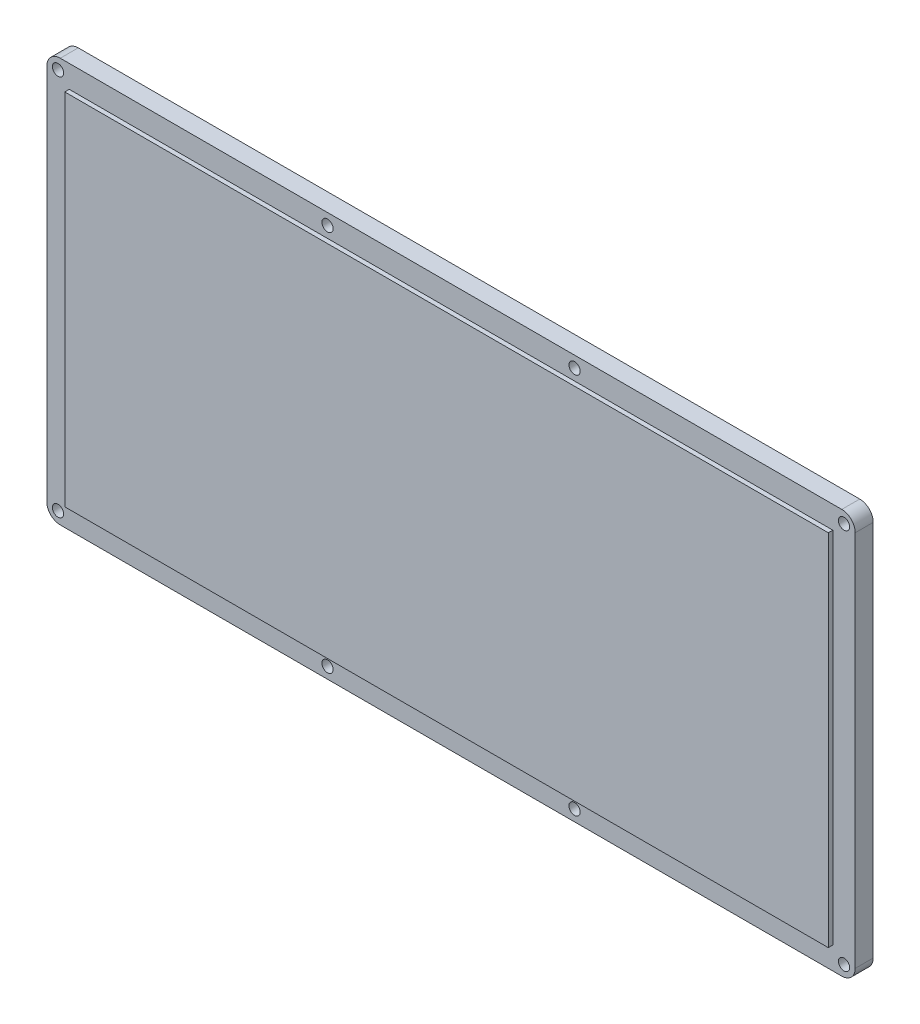
from build123d import *

# Parameters (mm, degrees)
SKETCH1_W           = 180
SKETCH1_H           = 90
BOSS_EXTRUDE1_DEPTH = 4
FILLET1_R           = 3
SKETCH2_W           = 170
SKETCH2_H           = 80
BOSS_EXTRUDE2_DEPTH = 1
SKETCH3_R           = 1.25
CUT_EXTRUDE2_DEPTH  = 10
BOSS_EXTRUDE3_DEPTH = 0.5
BOSS_EXTRUDE4_DEPTH = 0.5


with BuildPart() as part:
    # Sketch1 → Boss-Extrude1 (new body)
    with BuildSketch(Plane.XY):
        Rectangle(SKETCH1_W, SKETCH1_H)
    extrude(amount=BOSS_EXTRUDE1_DEPTH)

    # Fillet1
    fillet1_edges = [part.edges().sort_by_distance(p)[0] for p in [
        (90, 45, 2),
        (90, -45, 2),
        (-90, -45, 2),
        (-90, 45, 2),
    ]]
    fillet(fillet1_edges, radius=FILLET1_R)

    # Sketch2 → Boss-Extrude2 (add)
    with BuildSketch(Plane.XY.offset(4)):
        Rectangle(SKETCH2_W, SKETCH2_H)
    extrude(amount=BOSS_EXTRUDE2_DEPTH)

    # Sketch3 → Cut-Extrude2 (cut)
    with BuildSketch(Plane(origin=(0, 0, 0), x_dir=(-1, 0, 0), z_dir=(0, 0, -1))):
        with Locations((-87.5, 42.5)):
            Circle(SKETCH3_R)
        with Locations((87.5, 42.5)):
            Circle(SKETCH3_R)
        with Locations((87.5, -42.5)):
            Circle(SKETCH3_R)
        with Locations((-87.5, -42.5)):
            Circle(SKETCH3_R)
        with Locations((-27.5, -42.5)):
            Circle(SKETCH3_R)
        with Locations((27.5, 42.5)):
            Circle(SKETCH3_R)
        with Locations((27.5, -42.5)):
            Circle(SKETCH3_R)
        with Locations((-27.5, 42.5)):
            Circle(SKETCH3_R)
    extrude(amount=-CUT_EXTRUDE2_DEPTH, mode=Mode.SUBTRACT)

    # Sketch4 → Boss-Extrude3 (add)
    # profile 1 of 4: a face of its own
    with BuildSketch(Plane(origin=(0, 0, 0), x_dir=(-1, 0, 0), z_dir=(0, 0, -1))):
        with BuildLine():
            add(Edge.make_bspline(
                [(14.352587208, -9.355241917), (14.683794805, -9.363817475), (15.337673619, -9.380747569), (16.299293393, -9.521873111), (17.225991848, -9.751816949), (18.117349934, -10.071455517), (18.971135793, -10.48944625), (19.790361013, -10.993938837), (20.572091168, -11.594455273), (21.308315714, -12.2769865), (21.988719976, -13.019209408), (22.578290666, -13.818344325), (23.081054922, -14.653684863), (23.497747282, -15.527469341), (23.815136073, -16.445749133), (24.037860916, -17.403842226), (24.180950593, -18.401476052), (24.197408108, -19.080728708), (24.205772304, -19.425945042)],
                knots=[0, 0, 0, 0, 1.014329547, 2.002516266, 2.970391464, 3.935626869, 4.897733899, 5.877609409, 6.878433252, 7.912639331, 8.949961323, 9.958554974, 10.949718813, 11.932905612, 12.9188844, 13.919928257, 14.942845884, 16, 16, 16, 16], degree=3))
            add(Edge.make_bspline(
                [(24.205772304, -19.425945042), (24.196864797, -19.767271586), (24.179312268, -20.43986649), (24.043702463, -21.428306728), (23.817226906, -22.376136648), (23.505221277, -23.285501685), (23.096086141, -24.151997188), (22.603126336, -24.981155609), (22.01333359, -25.76528216), (21.34821996, -26.503956048), (20.615987575, -27.174461104), (19.840437238, -27.765342527), (19.025149963, -28.266033146), (18.171319069, -28.676303621), (17.277113558, -28.994699427), (16.344742225, -29.219350805), (15.374262767, -29.355875983), (14.714289672, -29.373313861), (14.379299949, -29.382164994)],
                knots=[0, 0, 0, 0, 1.051557043, 2.072126891, 3.067553643, 4.050577992, 5.02905126, 6.015227836, 7.017913613, 8.04756643, 9.074058332, 10.072836633, 11.047628519, 12.017157415, 12.98668631, 13.966869689, 14.968021931, 16, 16, 16, 16], degree=3))
            add(Edge.make_bspline(
                [(14.379299949, -29.382164994), (14.028940865, -29.374225091), (13.340533156, -29.358624267), (12.333045392, -29.210267552), (11.36778506, -28.986790513), (10.452860902, -28.653263022), (9.578955199, -28.236325613), (8.75248879, -27.722842197), (7.973739425, -27.113661344), (7.247174136, -26.424384403), (6.588904225, -25.670164248), (6.007851908, -24.873397538), (5.51772139, -24.04017087), (5.118494736, -23.170094276), (4.803760479, -22.26857507), (4.581751222, -21.33012274), (4.450605055, -20.356988036), (4.432337156, -19.696015491), (4.423079997, -19.361071244)],
                knots=[0, 0, 0, 0, 1.067978421, 2.098431617, 3.099715153, 4.085208694, 5.062210972, 6.048429807, 7.046490867, 8.072918869, 9.098532598, 10.095778865, 11.076610158, 12.041847152, 13.011192615, 13.984257998, 14.978533688, 16, 16, 16, 16], degree=3))
            add(Edge.make_bspline(
                [(4.423079997, -19.361071244), (4.425985427, -19.135738289), (4.431759497, -18.687925611), (4.501314253, -18.024290081), (4.601453104, -17.373607826), (4.749553714, -16.738473125), (4.929458102, -16.114405398), (5.16254965, -15.507213622), (5.427870911, -14.910411319), (5.737873824, -14.331047472), (6.082567089, -13.774452712), (6.45865813, -13.243252594), (6.867092622, -12.743870103), (7.306554864, -12.273023505), (7.778559301, -11.833807707), (8.276897203, -11.420004998), (8.811233423, -11.042607451), (9.369873018, -10.692398263), (9.949666507, -10.375710168), (10.548253603, -10.106154733), (11.153302231, -9.870756563), (11.772895023, -9.684969919), (12.400391942, -9.533648641), (13.04249652, -9.433577283), (13.693407707, -9.364024453), (14.132339253, -9.358176377), (14.352587208, -9.355241917)],
                knots=[0, 0, 0, 0, 1.034744296, 2.056386356, 3.06226378, 4.057406941, 5.050368692, 6.043467995, 7.042652155, 8.049140477, 9.059438543, 10.048523776, 11.036952808, 12.020949711, 13.004946614, 13.997082645, 14.994316842, 16.007702937, 17.024872941, 18.026463647, 19.021641123, 20.005082605, 20.995858141, 21.984425357, 22.988620895, 24, 24, 24, 24], degree=3))
        make_face()
        with BuildLine():
            add(Edge.make_bspline(
                [(14.299161728, -12.774472687), (14.076259059, -12.780453666), (13.636338388, -12.792257725), (12.99105488, -12.882188692), (12.371559924, -13.025818668), (11.781287626, -13.233864933), (11.217679695, -13.498655026), (10.679737026, -13.819263739), (10.174909016, -14.206711636), (9.69646427, -14.640198369), (9.26426817, -15.123202211), (8.882409282, -15.640822971), (8.562854898, -16.192196231), (8.2952261, -16.772199863), (8.093760929, -17.387355856), (7.950263329, -18.032845625), (7.859578202, -18.709781382), (7.848147229, -19.171247607), (7.842310766, -19.406864514)],
                knots=[0, 0, 0, 0, 1.033739768, 2.040188636, 3.016340934, 3.979330865, 4.937572243, 5.900995986, 6.878200029, 7.884839167, 8.891893314, 9.879764717, 10.863503415, 11.843163062, 12.837761627, 13.859916423, 14.907309254, 16, 16, 16, 16], degree=3))
            add(Edge.make_bspline(
                [(7.842310766, -19.406864514), (7.850049025, -19.667981048), (7.86521473, -20.17972619), (7.971922474, -20.926246215), (8.154488802, -21.631260287), (8.418111031, -22.291320287), (8.745071756, -22.913755687), (9.151105085, -23.490937656), (9.6296352, -24.026322091), (9.998290924, -24.338901824), (10.185399708, -24.49754961)],
                knots=[0, 0, 0, 0, 1.078454662, 2.113592447, 3.107694534, 4.079536787, 5.043276885, 6.005368276, 6.987637804, 8, 8, 8, 8], degree=3))
            add(Edge.make_bspline(
                [(10.185399708, -24.49754961), (10.338677524, -24.6147525), (10.641779781, -24.84651768), (11.125596973, -25.143572303), (11.623833413, -25.398177749), (12.14024892, -25.603895936), (12.673752849, -25.765710405), (13.224272043, -25.879026417), (13.79102646, -25.950142014), (14.174292359, -25.958641675), (14.367851631, -25.962934225)],
                knots=[0, 0, 0, 0, 1.023928204, 2.024787132, 3.009472467, 3.9914905, 4.972207045, 5.96565515, 6.972602802, 8, 8, 8, 8], degree=3))
            add(Edge.make_bspline(
                [(14.367851631, -25.962934225), (14.586921484, -25.956902534), (15.017948307, -25.945034992), (15.651219514, -25.856211125), (16.257912564, -25.705889071), (16.841793859, -25.499667862), (17.401179747, -25.2315531), (17.933336355, -24.901000111), (18.4391967, -24.51206766), (18.917031914, -24.072888297), (19.353795888, -23.587981754), (19.734857915, -23.067600058), (20.064572532, -22.523208776), (20.326635985, -21.947102875), (20.53606059, -21.344720525), (20.677831122, -20.713393903), (20.769282332, -20.055725578), (20.780716526, -19.608159042), (20.786541535, -19.380151773)],
                knots=[0, 0, 0, 0, 1.026359118, 2.019393844, 2.989460624, 3.950973911, 4.916101784, 5.890408035, 6.881132271, 7.902007068, 8.92769091, 9.933912415, 10.920395702, 11.90457117, 12.894218921, 13.903490204, 14.931958862, 16, 16, 16, 16], degree=3))
            add(Edge.make_bspline(
                [(20.786541535, -19.380151773), (20.78051498, -19.153455609), (20.768652624, -18.707238783), (20.679672422, -18.051261319), (20.530303672, -17.422721819), (20.323463202, -16.820593813), (20.059338874, -16.24428699), (19.732722348, -15.695827986), (19.344759681, -15.175747027), (18.90437981, -14.687588267), (18.425053386, -14.239001635), (17.910448576, -13.849709984), (17.374964601, -13.511427916), (16.806314845, -13.246431404), (16.216133405, -13.035309244), (15.600818965, -12.879835857), (14.958040982, -12.792889494), (14.52074583, -12.780666343), (14.299161728, -12.774472687)],
                knots=[0, 0, 0, 0, 1.055025985, 2.07665775, 3.074803781, 4.057872707, 5.035505728, 6.020516407, 7.023567878, 8.050795229, 9.077271434, 10.074415901, 11.050397877, 12.019801805, 12.988065821, 13.964604439, 14.968634123, 16, 16, 16, 16], degree=3))
        make_face(mode=Mode.SUBTRACT)
    # profile 2 of 4: a face of its own
    with BuildSketch(Plane(origin=(0, 0, 0), x_dir=(-1, 0, 0), z_dir=(0, 0, -1))):
        with BuildLine():
            Line((37.394233843, -12.389046004), (34.837442978, -14.72831884))
            add(Edge.make_bspline(
                [(34.837442978, -14.72831884), (34.72792102, -14.573826734), (34.517654135, -14.277223433), (34.176833446, -13.880064622), (33.837551738, -13.541258601), (33.49666577, -13.262220743), (33.151154061, -13.044646412), (32.801616367, -12.890601383), (32.450034316, -12.792673495), (32.21382545, -12.780479117), (32.097479035, -12.774472687)],
                knots=[0, 0, 0, 0, 1.299362458, 2.494594718, 3.587462134, 4.587049575, 5.512617175, 6.380583204, 7.202344345, 8, 8, 8, 8], degree=3))
            add(Edge.make_bspline(
                [(32.097479035, -12.774472687), (31.988954437, -12.778278637), (31.77942195, -12.785626926), (31.480717846, -12.858668376), (31.215524088, -12.984727191), (30.984099494, -13.149559698), (30.800777071, -13.348144654), (30.654408333, -13.556409212), (30.571990435, -13.786286185), (30.561142617, -13.944174962), (30.555772304, -14.022339273)],
                knots=[0, 0, 0, 0, 1.185010067, 2.2879431, 3.333075148, 4.379039566, 5.372662701, 6.27520591, 7.14612461, 8, 8, 8, 8], degree=3))
            add(Edge.make_bspline(
                [(30.555772304, -14.022339273), (30.559137607, -14.101630748), (30.56591486, -14.26131276), (30.631373892, -14.495346635), (30.730039345, -14.724024974), (30.824318213, -14.863232361), (30.872509083, -14.934388552)],
                knots=[0, 0, 0, 0, 0.967525499, 1.948461899, 2.951351359, 4, 4, 4, 4], degree=3))
            add(Edge.make_bspline(
                [(30.872509083, -14.934388552), (30.916319798, -14.989697515), (31.017166276, -15.117011442), (31.209459856, -15.318656858), (31.450940208, -15.565690142), (31.750900003, -15.849616545), (32.096887086, -16.180647169), (32.504938406, -16.545769076), (32.963308464, -16.956289665), (33.289107282, -17.242161338), (33.459828795, -17.391960667)],
                knots=[0, 0, 0, 0, 0.473873513, 1.090794244, 1.870441696, 2.795289791, 3.865433203, 5.087734844, 6.473946851, 8, 8, 8, 8], degree=3))
            add(Edge.make_bspline(
                [(33.459828795, -17.391960667), (33.620075492, -17.530646101), (33.924190432, -17.793842242), (34.356885599, -18.167406904), (34.737152587, -18.503493923), (35.070531016, -18.79705935), (35.351967197, -19.051183359), (35.582644286, -19.26708066), (35.765379614, -19.440548129), (35.869253949, -19.545322586), (35.913584804, -19.59003759)],
                knots=[0, 0, 0, 0, 1.543621617, 2.929473131, 4.163658386, 5.240097082, 6.164993805, 6.925417477, 7.541396219, 8, 8, 8, 8], degree=3))
            add(Edge.make_bspline(
                [(35.913584804, -19.59003759), (36.081766829, -19.77204656), (36.405071742, -20.121931718), (36.825254156, -20.664143676), (37.171077875, -21.193453106), (37.438613662, -21.719819824), (37.640667448, -22.250838254), (37.783118045, -22.799531594), (37.868432654, -23.371633345), (37.877904568, -23.762022951), (37.882695381, -23.959478696)],
                knots=[0, 0, 0, 0, 1.206664779, 2.319633467, 3.337109185, 4.282041471, 5.190008762, 6.099243693, 7.03861361, 8, 8, 8, 8], degree=3))
            add(Edge.make_bspline(
                [(37.882695381, -23.959478696), (37.879285403, -24.151875104), (37.872594899, -24.529364018), (37.79064905, -25.081762813), (37.673799081, -25.610432435), (37.493128528, -26.10962021), (37.272928328, -26.587520153), (36.996875575, -27.036688104), (36.672689469, -27.461669825), (36.301122415, -27.854868248), (35.890125131, -28.211668563), (35.449291484, -28.529300631), (34.97431078, -28.791546362), (34.46924118, -29.007487016), (33.934353035, -29.173807395), (33.370283559, -29.296733656), (32.776169969, -29.37051206), (32.369906535, -29.378224717), (32.162352833, -29.382164994)],
                knots=[0, 0, 0, 0, 1.043214005, 2.046824704, 3.02475056, 3.976699089, 4.921714032, 5.875962561, 6.831408892, 7.817874052, 8.806269674, 9.781291748, 10.760897367, 11.74438705, 12.757449933, 13.795994037, 14.874007457, 16, 16, 16, 16], degree=3))
            add(Edge.make_bspline(
                [(32.162352833, -29.382164994), (31.999424945, -29.379274545), (31.676734286, -29.373549798), (31.20113704, -29.326812001), (30.741894135, -29.251382171), (30.299522869, -29.143268691), (29.872030279, -29.006274248), (29.45939881, -28.838940785), (29.064476994, -28.638674694), (28.684276664, -28.409594244), (28.320646065, -28.143601665), (27.968987229, -27.84613509), (27.632793166, -27.512619349), (27.310449205, -27.143843195), (27.004017792, -26.738762341), (26.703468327, -26.303018288), (26.422158132, -25.828524218), (26.248380312, -25.49566279), (26.159618458, -25.325644562)],
                knots=[0, 0, 0, 0, 1.016823716, 2.013894106, 2.979844003, 3.91962641, 4.853723003, 5.779685073, 6.695824784, 7.614987388, 8.547259901, 9.504950863, 10.487499108, 11.500346958, 12.559593716, 13.656357062, 14.802919212, 16, 16, 16, 16], degree=3))
            Line((26.159618458, -25.325644562), (29.166709804, -23.520626533))
            add(Edge.make_bspline(
                [(29.166709804, -23.520626533), (29.277737617, -23.713619436), (29.490587422, -24.083603327), (29.851281315, -24.580723576), (30.220793795, -25.006424782), (30.607667658, -25.353182646), (31.007198664, -25.625633769), (31.42131664, -25.820346243), (31.850312538, -25.940873044), (32.142525054, -25.95559215), (32.288284324, -25.962934225)],
                knots=[0, 0, 0, 0, 1.283663364, 2.460892379, 3.537111102, 4.529833553, 5.449777664, 6.316464042, 7.160231139, 8, 8, 8, 8], degree=3))
            add(Edge.make_bspline(
                [(32.288284324, -25.962934225), (32.436542369, -25.956938289), (32.724184569, -25.945305299), (33.134757002, -25.837854878), (33.511185355, -25.669149835), (33.836567242, -25.428431002), (34.11208011, -25.150604882), (34.31542442, -24.841510621), (34.443166688, -24.507078091), (34.456672142, -24.274759257), (34.463464612, -24.157916196)],
                knots=[0, 0, 0, 0, 1.13588714, 2.203786484, 3.234766741, 4.283437687, 5.291419208, 6.222934724, 7.106237994, 8, 8, 8, 8], degree=3))
            add(Edge.make_bspline(
                [(34.463464612, -24.157916196), (34.457192044, -24.049212742), (34.444449923, -23.82839208), (34.350595385, -23.500067265), (34.203872116, -23.171891766), (34.030288142, -22.902713342), (33.853644713, -22.677337545), (33.684733752, -22.482059612), (33.479044885, -22.266311683), (33.237099647, -22.029822363), (32.962094766, -21.770509777), (32.653798586, -21.488399318), (32.308680789, -21.185976041), (32.06475085, -20.979968293), (31.937202593, -20.872249129)],
                knots=[0, 0, 0, 0, 0.916159276, 1.861089862, 2.860218735, 3.940849679, 4.552606315, 5.27541173, 6.11797699, 7.06649574, 8.129236253, 9.306560635, 10.591630461, 12, 12, 12, 12], degree=3))
            add(Edge.make_bspline(
                [(31.937202593, -20.872249129), (31.69472828, -20.667092609), (31.229346681, -20.27333515), (30.571703439, -19.691767779), (29.979107993, -19.148239782), (29.456678634, -18.636031966), (28.997758804, -18.164603621), (28.605456508, -17.730125626), (28.284081363, -17.329246577), (27.945903321, -16.85443217), (27.624566567, -16.275838191), (27.346840424, -15.579722559), (27.166663424, -14.883695254), (27.146477098, -14.416420858), (27.136541535, -14.186431821)],
                knots=[0, 0, 0, 0, 1.345494975, 2.582412109, 3.71882943, 4.751509156, 5.681369928, 6.505683931, 7.230279997, 7.856715994, 8.973648664, 10.023341002, 11.027102913, 12, 12, 12, 12], degree=3))
            add(Edge.make_bspline(
                [(27.136541535, -14.186431821), (27.140673722, -14.023335941), (27.148814575, -13.702019537), (27.221432235, -13.229570582), (27.329962095, -12.773697037), (27.487578609, -12.336062137), (27.692145813, -11.917214037), (27.940584737, -11.515102299), (28.236753165, -11.133427869), (28.570514989, -10.772443769), (28.938235067, -10.442545382), (29.331190701, -10.151377), (29.747157727, -9.90545195), (30.18359147, -9.701439264), (30.643196327, -9.545280513), (31.122586411, -9.434587407), (31.62244932, -9.368750677), (31.962445281, -9.359800938), (32.135640093, -9.355241917)],
                knots=[0, 0, 0, 0, 1.010766082, 1.991317756, 2.957454644, 3.913069143, 4.869106762, 5.843196583, 6.838735724, 7.860187025, 8.887984031, 9.89767229, 10.887916223, 11.879572884, 12.879850636, 13.892031539, 14.926195476, 16, 16, 16, 16], degree=3))
            add(Edge.make_bspline(
                [(32.135640093, -9.355241917), (32.360091997, -9.363452846), (32.80722406, -9.37980989), (33.468321712, -9.507716625), (34.114054257, -9.708863439), (34.634397644, -9.95152494), (35.048425165, -10.186591251), (35.365738584, -10.4030107), (35.688622067, -10.65093081), (36.01967947, -10.931132843), (36.352759234, -11.248896174), (36.697332409, -11.596656196), (37.048703764, -11.977418369), (37.277039433, -12.2494331), (37.394233843, -12.389046004)],
                knots=[0, 0, 0, 0, 1.282922637, 2.555718331, 3.837320111, 5.142675274, 5.830281639, 6.55870424, 7.337177975, 8.157850921, 9.037902056, 9.96903443, 10.957596896, 12, 12, 12, 12], degree=3))
        make_face()
    # profile 3 of 4: a face of its own
    with BuildSketch(Plane(origin=(0, 0, 0), x_dir=(-1, 0, 0), z_dir=(0, 0, -1))):
        with BuildLine():
            Line((58.398079997, -13.148451052), (55.890898506, -15.544965475))
            add(Edge.make_bspline(
                [(55.890898506, -15.544965475), (55.678218947, -15.325054454), (55.262789137, -14.895499334), (54.593375375, -14.326806211), (53.897209437, -13.852877439), (53.187833841, -13.453737646), (52.452488976, -13.151759945), (51.699677432, -12.931703708), (50.924592285, -12.797543738), (50.400044469, -12.782193463), (50.136211006, -12.774472687)],
                knots=[0, 0, 0, 0, 1.115251505, 2.178435587, 3.19620269, 4.182487026, 5.141301733, 6.088180966, 7.038406374, 8, 8, 8, 8], degree=3))
            add(Edge.make_bspline(
                [(50.136211006, -12.774472687), (49.915878003, -12.78057237), (49.481075097, -12.792609422), (48.84267049, -12.880852887), (48.23200349, -13.03091474), (47.646983688, -13.237727771), (47.089332528, -13.505332856), (46.557880826, -13.833522876), (46.053938855, -14.219333808), (45.584163395, -14.660769449), (45.154429314, -15.14307106), (44.77473189, -15.657685727), (44.456674391, -16.203434499), (44.195649775, -16.774790432), (43.99232169, -17.374398045), (43.847119891, -18.001853658), (43.763139051, -18.657904522), (43.750604348, -19.10388301), (43.744233843, -19.330542398)],
                knots=[0, 0, 0, 0, 1.035432265, 2.043311493, 3.022114605, 3.98653278, 4.95457646, 5.923598177, 6.917315552, 7.932509744, 8.948865224, 9.949768934, 10.933144597, 11.912367597, 12.897413939, 13.903909035, 14.934704909, 16, 16, 16, 16], degree=3))
            add(Edge.make_bspline(
                [(43.744233843, -19.330542398), (43.74606975, -19.489627815), (43.74968836, -19.803188441), (43.789300447, -20.267031632), (43.853085248, -20.717069185), (43.945397659, -21.152619414), (44.060835235, -21.574059768), (44.196269797, -21.985025995), (44.366170463, -22.379839464), (44.554762766, -22.763085679), (44.774093441, -23.124307287), (45.01057237, -23.468762069), (45.266995158, -23.794761541), (45.545022673, -24.100973009), (45.848567805, -24.382611073), (46.169785036, -24.648144924), (46.514092855, -24.89092735), (46.874339117, -25.117051245), (47.253635895, -25.313486996), (47.641691986, -25.491419836), (48.044391105, -25.635927758), (48.456830147, -25.752414325), (48.8775352, -25.851468754), (49.31062115, -25.91245961), (49.752333686, -25.958647271), (50.050857218, -25.961499089), (50.201084804, -25.962934225)],
                knots=[0, 0, 0, 0, 1.103660481, 2.175337485, 3.227646561, 4.255952547, 5.262355991, 6.258840057, 7.255597736, 8.242457506, 9.22035537, 10.185017736, 11.140346927, 12.096287581, 13.051739095, 14.01125915, 14.986044842, 15.97314143, 16.960198552, 17.947847494, 18.933482797, 19.925264591, 20.920966487, 21.929612487, 22.958107872, 24, 24, 24, 24], degree=3))
            add(Edge.make_bspline(
                [(50.201084804, -25.962934225), (50.455896608, -25.955563715), (50.956535541, -25.941082581), (51.691295161, -25.827842158), (52.391447878, -25.641568071), (52.950866549, -25.421589197), (53.389156301, -25.204357204), (53.722819811, -25.003428308), (54.067853885, -24.778667277), (54.418527803, -24.521591386), (54.778785951, -24.235285649), (55.142268942, -23.913479436), (55.518282005, -23.566769365), (55.764604436, -23.319315576), (55.890898506, -23.192441437)],
                knots=[0, 0, 0, 0, 1.404581149, 2.759636711, 4.088442092, 5.392261763, 6.066678138, 6.783632037, 7.538459478, 8.336747902, 9.180226004, 10.074962426, 11.012997595, 12, 12, 12, 12], degree=3))
            Line((55.890898506, -23.192441437), (58.321757881, -25.745416196))
            add(Edge.make_bspline(
                [(58.321757881, -25.745416196), (58.150881552, -25.910391928), (57.817367499, -26.232389275), (57.314270809, -26.689595462), (56.811807287, -27.100446046), (56.322115403, -27.479853103), (55.837173495, -27.816763584), (55.357032989, -28.111513967), (54.887129286, -28.371558913), (54.417704685, -28.592512893), (53.945838184, -28.78012577), (53.460343006, -28.941648144), (52.959734947, -29.07829026), (52.440956522, -29.188542503), (51.908846579, -29.276949918), (51.358425276, -29.336624412), (50.793182556, -29.376741588), (50.409769662, -29.380346449), (50.216349228, -29.382164994)],
                knots=[0, 0, 0, 0, 1.244526981, 2.429050516, 3.560637417, 4.644440555, 5.67424972, 6.652764056, 7.595344123, 8.486817594, 9.369275933, 10.254498637, 11.166417451, 12.086725134, 13.032340136, 13.991389299, 14.986715468, 16, 16, 16, 16], degree=3))
            add(Edge.make_bspline(
                [(50.216349228, -29.382164994), (49.861059848, -29.373107959), (49.165857291, -29.35538586), (48.14705607, -29.224077101), (47.179222259, -29.003940279), (46.260001298, -28.692606095), (45.389685478, -28.294891266), (44.568497453, -27.80731156), (43.797760796, -27.2311624), (43.083701541, -26.573196814), (42.437800961, -25.846529061), (41.866899648, -25.066287247), (41.39465006, -24.228636772), (41.002531052, -23.345952407), (40.695899144, -22.414206122), (40.480082264, -21.432390052), (40.346989568, -20.401452199), (40.332429038, -19.69729788), (40.325003074, -19.33817461)],
                knots=[0, 0, 0, 0, 1.078019885, 2.10938526, 3.111377082, 4.085535484, 5.04941344, 6.010039228, 6.978205633, 7.964457913, 8.951525778, 9.924444315, 10.892603023, 11.863865945, 12.85144698, 13.863884204, 14.910567087, 16, 16, 16, 16], degree=3))
            add(Edge.make_bspline(
                [(40.325003074, -19.33817461), (40.328140927, -19.103957477), (40.334359384, -18.639796364), (40.399715946, -17.956049439), (40.490826795, -17.289518491), (40.635365871, -16.64712432), (40.809593471, -16.020212691), (41.026268383, -15.415597402), (41.285044547, -14.831540727), (41.577580998, -14.267064921), (41.908524558, -13.725867905), (42.278224845, -13.212599413), (42.677164332, -12.723297109), (43.114928886, -12.264452495), (43.585157213, -11.832036826), (44.089972341, -11.428393446), (44.626338059, -11.047733653), (45.19570611, -10.699873739), (45.787015189, -10.385215958), (46.392807332, -10.107674356), (47.01159418, -9.87571349), (47.640759444, -9.683310508), (48.282961341, -9.539695287), (48.933615995, -9.430983197), (49.598259698, -9.370212444), (50.044510365, -9.360263884), (50.269774708, -9.355241917)],
                knots=[0, 0, 0, 0, 1.071919942, 2.124283339, 3.142214191, 4.149696895, 5.136002878, 6.119640489, 7.086990633, 8.058538607, 9.028339693, 9.988281803, 10.952401235, 11.916291999, 12.888973767, 13.874849856, 14.873389453, 15.898127285, 16.927174885, 17.938320013, 18.946391617, 19.950418109, 20.947802303, 21.956882652, 22.968648068, 24, 24, 24, 24], degree=3))
            add(Edge.make_bspline(
                [(50.269774708, -9.355241917), (50.46194829, -9.358120634), (50.844297384, -9.363848136), (51.413679345, -9.411593099), (51.978507655, -9.486576081), (52.536760057, -9.599709432), (53.092429741, -9.734013017), (53.638214586, -9.909865035), (54.182724643, -10.105885249), (54.717420079, -10.34018739), (55.243047252, -10.595949341), (55.747292517, -10.886120562), (56.238622106, -11.192844241), (56.706148449, -11.534273629), (57.158629321, -11.898024447), (57.593698662, -12.285793798), (58.007538483, -12.704046933), (58.267241376, -12.999567463), (58.398079997, -13.148451052)],
                knots=[0, 0, 0, 0, 0.996412454, 1.982464992, 2.961075852, 3.949442424, 4.934965278, 5.923860011, 6.921385422, 7.934793307, 8.949617135, 9.951082467, 10.950285876, 11.951772932, 12.951063433, 13.960125323, 14.972308753, 16, 16, 16, 16], degree=3))
        make_face()
    # profile 4 of 4: a face of its own
    with BuildSketch(Plane(origin=(0, 0, 0), x_dir=(-1, 0, 0), z_dir=(0, 0, -1))):
        with BuildLine():
            Line((78.913464612, -13.148451052), (76.406283122, -15.544965475))
            add(Edge.make_bspline(
                [(76.406283122, -15.544965475), (76.193603562, -15.325054454), (75.778173752, -14.895499334), (75.108759991, -14.326806211), (74.412594053, -13.852877439), (73.703218457, -13.453737646), (72.967873592, -13.151759945), (72.215062047, -12.931703708), (71.4399769, -12.797543738), (70.915429085, -12.782193463), (70.651595622, -12.774472687)],
                knots=[0, 0, 0, 0, 1.115251505, 2.178435587, 3.19620269, 4.182487026, 5.141301733, 6.088180966, 7.038406374, 8, 8, 8, 8], degree=3))
            add(Edge.make_bspline(
                [(70.651595622, -12.774472687), (70.431262618, -12.78057237), (69.996459712, -12.792609422), (69.358055105, -12.880852887), (68.747388106, -13.03091474), (68.162368303, -13.237727771), (67.604717143, -13.505332856), (67.073265442, -13.833522876), (66.56932347, -14.219333808), (66.09954801, -14.660769449), (65.669813929, -15.14307106), (65.290116506, -15.657685727), (64.972059007, -16.203434499), (64.711034391, -16.774790432), (64.507706305, -17.374398045), (64.362504506, -18.001853658), (64.278523666, -18.657904522), (64.265988963, -19.10388301), (64.259618458, -19.330542398)],
                knots=[0, 0, 0, 0, 1.035432265, 2.043311493, 3.022114605, 3.98653278, 4.95457646, 5.923598177, 6.917315552, 7.932509744, 8.948865224, 9.949768934, 10.933144597, 11.912367597, 12.897413939, 13.903909035, 14.934704909, 16, 16, 16, 16], degree=3))
            add(Edge.make_bspline(
                [(64.259618458, -19.330542398), (64.261454365, -19.489627815), (64.265072975, -19.803188441), (64.304685063, -20.267031632), (64.368469864, -20.717069185), (64.460782274, -21.152619414), (64.57621985, -21.574059768), (64.711654413, -21.985025995), (64.881555079, -22.379839464), (65.070147381, -22.763085679), (65.289478056, -23.124307287), (65.525956985, -23.468762069), (65.782379774, -23.794761541), (66.060407289, -24.100973009), (66.363952421, -24.382611073), (66.685169651, -24.648144924), (67.02947747, -24.89092735), (67.389723733, -25.117051245), (67.76902051, -25.313486996), (68.157076602, -25.491419836), (68.55977572, -25.635927758), (68.972214762, -25.752414325), (69.392919815, -25.851468754), (69.826005766, -25.91245961), (70.267718301, -25.958647271), (70.566241834, -25.961499089), (70.71646942, -25.962934225)],
                knots=[0, 0, 0, 0, 1.103660481, 2.175337485, 3.227646561, 4.255952547, 5.262355991, 6.258840057, 7.255597736, 8.242457506, 9.22035537, 10.185017736, 11.140346927, 12.096287581, 13.051739095, 14.01125915, 14.986044842, 15.97314143, 16.960198552, 17.947847494, 18.933482797, 19.925264591, 20.920966487, 21.929612487, 22.958107872, 24, 24, 24, 24], degree=3))
            add(Edge.make_bspline(
                [(70.71646942, -25.962934225), (70.971281223, -25.955563715), (71.471920156, -25.941082581), (72.206679776, -25.827842158), (72.906832494, -25.641568071), (73.466251165, -25.421589197), (73.904540917, -25.204357204), (74.238204426, -25.003428308), (74.5832385, -24.778667277), (74.933912418, -24.521591386), (75.294170566, -24.235285649), (75.657653557, -23.913479436), (76.033666621, -23.566769365), (76.279989051, -23.319315576), (76.406283122, -23.192441437)],
                knots=[0, 0, 0, 0, 1.404581149, 2.759636711, 4.088442092, 5.392261763, 6.066678138, 6.783632037, 7.538459478, 8.336747902, 9.180226004, 10.074962426, 11.012997595, 12, 12, 12, 12], degree=3))
            Line((76.406283122, -23.192441437), (78.837142497, -25.745416196))
            add(Edge.make_bspline(
                [(78.837142497, -25.745416196), (78.666266167, -25.910391928), (78.332752114, -26.232389275), (77.829655425, -26.689595462), (77.327191902, -27.100446046), (76.837500018, -27.479853103), (76.35255811, -27.816763584), (75.872417604, -28.111513967), (75.402513901, -28.371558913), (74.9330893, -28.592512893), (74.461222799, -28.78012577), (73.975727622, -28.941648144), (73.475119563, -29.07829026), (72.956341137, -29.188542503), (72.424231194, -29.276949918), (71.873809891, -29.336624412), (71.308567171, -29.376741588), (70.925154278, -29.380346449), (70.731733843, -29.382164994)],
                knots=[0, 0, 0, 0, 1.244526981, 2.429050516, 3.560637417, 4.644440555, 5.67424972, 6.652764056, 7.595344123, 8.486817594, 9.369275933, 10.254498637, 11.166417451, 12.086725134, 13.032340136, 13.991389299, 14.986715468, 16, 16, 16, 16], degree=3))
            add(Edge.make_bspline(
                [(70.731733843, -29.382164994), (70.376444463, -29.373107959), (69.681241907, -29.35538586), (68.662440686, -29.224077101), (67.694606874, -29.003940279), (66.775385913, -28.692606095), (65.905070093, -28.294891266), (65.083882069, -27.80731156), (64.313145411, -27.2311624), (63.599086156, -26.573196814), (62.953185577, -25.846529061), (62.382284264, -25.066287247), (61.910034676, -24.228636772), (61.517915667, -23.345952407), (61.211283759, -22.414206122), (60.995466879, -21.432390052), (60.862374184, -20.401452199), (60.847813654, -19.69729788), (60.840387689, -19.33817461)],
                knots=[0, 0, 0, 0, 1.078019885, 2.10938526, 3.111377082, 4.085535484, 5.04941344, 6.010039228, 6.978205633, 7.964457913, 8.951525778, 9.924444315, 10.892603023, 11.863865945, 12.85144698, 13.863884204, 14.910567087, 16, 16, 16, 16], degree=3))
            add(Edge.make_bspline(
                [(60.840387689, -19.33817461), (60.843525542, -19.103957477), (60.849743999, -18.639796364), (60.915100562, -17.956049439), (61.00621141, -17.289518491), (61.150750486, -16.64712432), (61.324978086, -16.020212691), (61.541652999, -15.415597402), (61.800429162, -14.831540727), (62.092965613, -14.267064921), (62.423909173, -13.725867905), (62.79360946, -13.212599413), (63.192548947, -12.723297109), (63.630313501, -12.264452495), (64.100541829, -11.832036826), (64.605356957, -11.428393446), (65.141722675, -11.047733653), (65.711090725, -10.699873739), (66.302399804, -10.385215958), (66.908191948, -10.107674356), (67.526978795, -9.87571349), (68.15614406, -9.683310508), (68.798345956, -9.539695287), (69.449000611, -9.430983197), (70.113644314, -9.370212444), (70.559894981, -9.360263884), (70.785159324, -9.355241917)],
                knots=[0, 0, 0, 0, 1.071919942, 2.124283339, 3.142214191, 4.149696895, 5.136002878, 6.119640489, 7.086990633, 8.058538607, 9.028339693, 9.988281803, 10.952401235, 11.916291999, 12.888973767, 13.874849856, 14.873389453, 15.898127285, 16.927174885, 17.938320013, 18.946391617, 19.950418109, 20.947802303, 21.956882652, 22.968648068, 24, 24, 24, 24], degree=3))
            add(Edge.make_bspline(
                [(70.785159324, -9.355241917), (70.977332906, -9.358120634), (71.359681999, -9.363848136), (71.92906396, -9.411593099), (72.493892271, -9.486576081), (73.052144672, -9.599709432), (73.607814357, -9.734013017), (74.153599202, -9.909865035), (74.698109258, -10.105885249), (75.232804695, -10.34018739), (75.758431868, -10.595949341), (76.262677133, -10.886120562), (76.754006721, -11.192844241), (77.221533064, -11.534273629), (77.674013937, -11.898024447), (78.109083277, -12.285793798), (78.522923098, -12.704046933), (78.782625991, -12.999567463), (78.913464612, -13.148451052)],
                knots=[0, 0, 0, 0, 0.996412454, 1.982464992, 2.961075852, 3.949442424, 4.934965278, 5.923860011, 6.921385422, 7.934793307, 8.949617135, 9.951082467, 10.950285876, 11.951772932, 12.951063433, 13.960125323, 14.972308753, 16, 16, 16, 16], degree=3))
        make_face()
    extrude(amount=BOSS_EXTRUDE3_DEPTH)

    # Sketch5 → Boss-Extrude4 (add)
    # profile 1 of 6: a face of its own
    with BuildSketch(Plane(origin=(0, 0, 0), x_dir=(-1, 0, 0), z_dir=(0, 0, -1))):
        Polygon((-72.162099663, 20.669846007), (-42.833259123, 37.68513306), (-42.833259123, 3.900781456), align=None)
        Polygon((-46.627046486, 30.933541204), (-64.318330732, 20.669846007), (-46.627046486, 10.554673294), align=None, mode=Mode.SUBTRACT)
    # profile 2 of 6: a face of its own
    with BuildSketch(Plane(origin=(0, 0, 0), x_dir=(-1, 0, 0), z_dir=(0, 0, -1))):
        Polygon((-72.268700107, -19.410645164), (-42.88675965, -2.487215965), (-42.88675965, -36.271567569), align=None)
    # profile 3 of 6: a face of its own
    with BuildSketch(Plane(origin=(0, 0, 0), x_dir=(-1, 0, 0), z_dir=(0, 0, -1))):
        Polygon((-37.410828241, 0.676109199), (-8.081860073, 17.691619475), (-8.081860073, -16.092732129), align=None)
    # profile 4 of 6: a face of its own
    with BuildSketch(Plane(origin=(0, 0, 0), x_dir=(-1, 0, 0), z_dir=(0, 0, -1))):
        Polygon((-39.245332342, -2.501161174), (-9.916234668, -19.270076546), (-39.245332342, -36.285512777), align=None)
    # profile 5 of 6: a face of its own
    with BuildSketch(Plane(origin=(0, 0, 0), x_dir=(-1, 0, 0), z_dir=(0, 0, -1))):
        Polygon((-73.792954146, 17.53572799), (-44.357432402, 0.705667369), (-73.792954146, -16.248623613), align=None)
    # profile 6 of 6: a face of its own
    with BuildSketch(Plane(origin=(0, 0, 0), x_dir=(-1, 0, 0), z_dir=(0, 0, -1))):
        Polygon((-39.23561891, 37.100261235), (-9.906585989, 20.269699991), (-39.23561891, 3.254152148), align=None)
    extrude(amount=BOSS_EXTRUDE4_DEPTH)


solid = part.part
